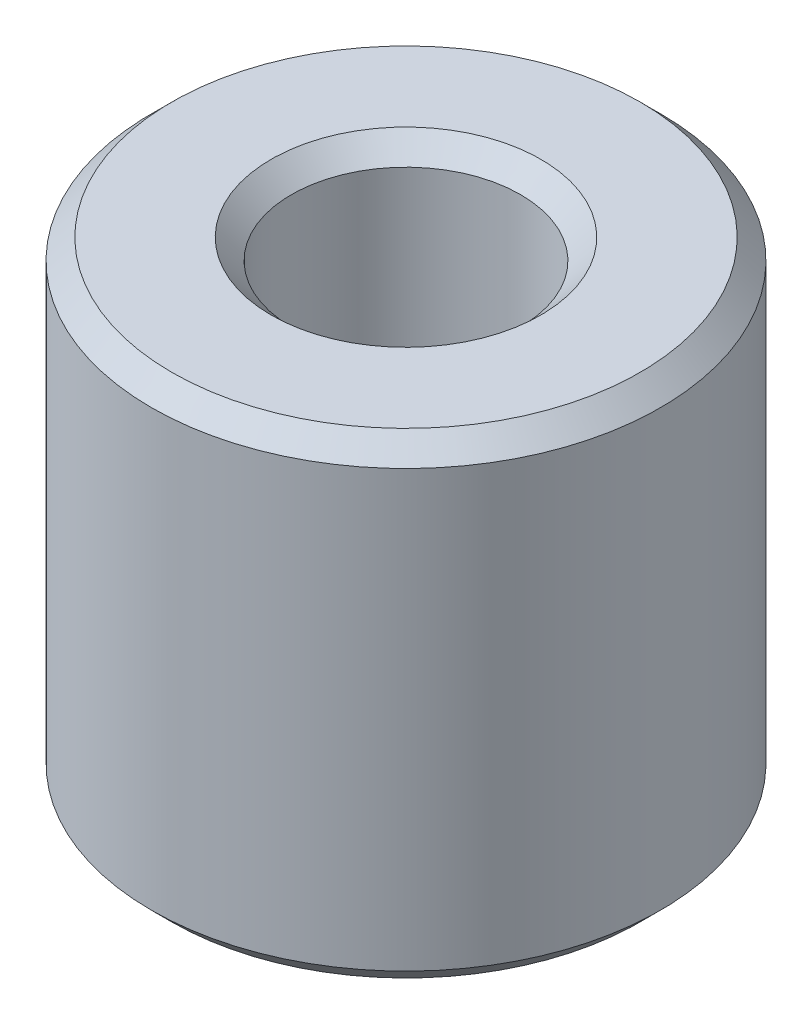
from build123d import *

# Parameters (mm, degrees)
SKETCH1_R        = 10
SKETCH1_R_2      = 4.5
BODY_DEPTH       = 18.7
CHAMFER_0_8_SIZE = 0.8


with BuildPart() as part:
    # Sketch1 → Body (new body)
    with BuildSketch(Plane(origin=(0, 0, 0), x_dir=(1, 0, 0), z_dir=(0, 1, 0))):
        Circle(SKETCH1_R)
        Circle(SKETCH1_R_2, mode=Mode.SUBTRACT)
    extrude(amount=BODY_DEPTH)

    # Chamfer 0.8
    chamfer_0_8_edges = [part.edges().sort_by_distance(p)[0] for p in [
        (-4.5, 0, 0),
        (-10, 0, 0),
        (-10, 18.7, 0),
        (-4.5, 18.7, 0),
    ]]
    chamfer(chamfer_0_8_edges, length=CHAMFER_0_8_SIZE)


solid = part.part
